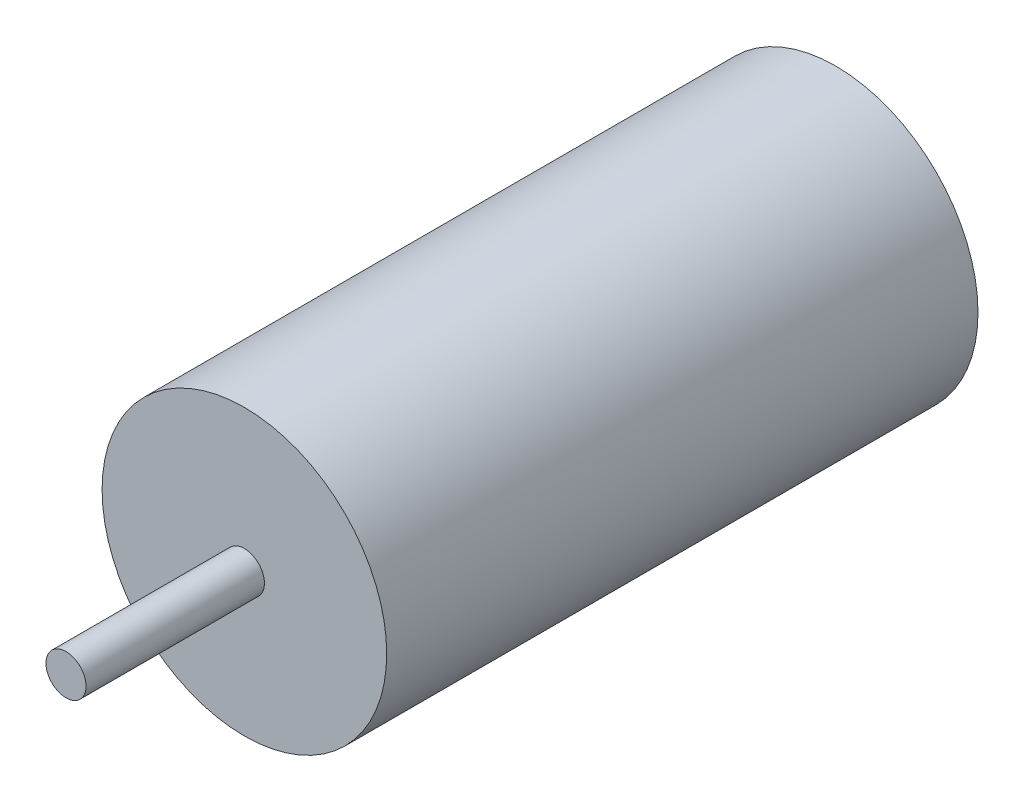
from build123d import *

# Parameters (mm, degrees)
SKETCH1_R           = 14.2
BOSS_EXTRUDE1_DEPTH = 59
SKETCH2_R           = 2
BOSS_EXTRUDE2_DEPTH = 17.8


with BuildPart() as part:
    # Sketch1 → Boss-Extrude1 (new body)
    with BuildSketch(Plane.XY):
        Circle(SKETCH1_R)
    extrude(amount=BOSS_EXTRUDE1_DEPTH)

    # Sketch2 → Boss-Extrude2 (add)
    with BuildSketch(Plane.XY.offset(59)):
        Circle(SKETCH2_R)
    extrude(amount=BOSS_EXTRUDE2_DEPTH)


solid = part.part
